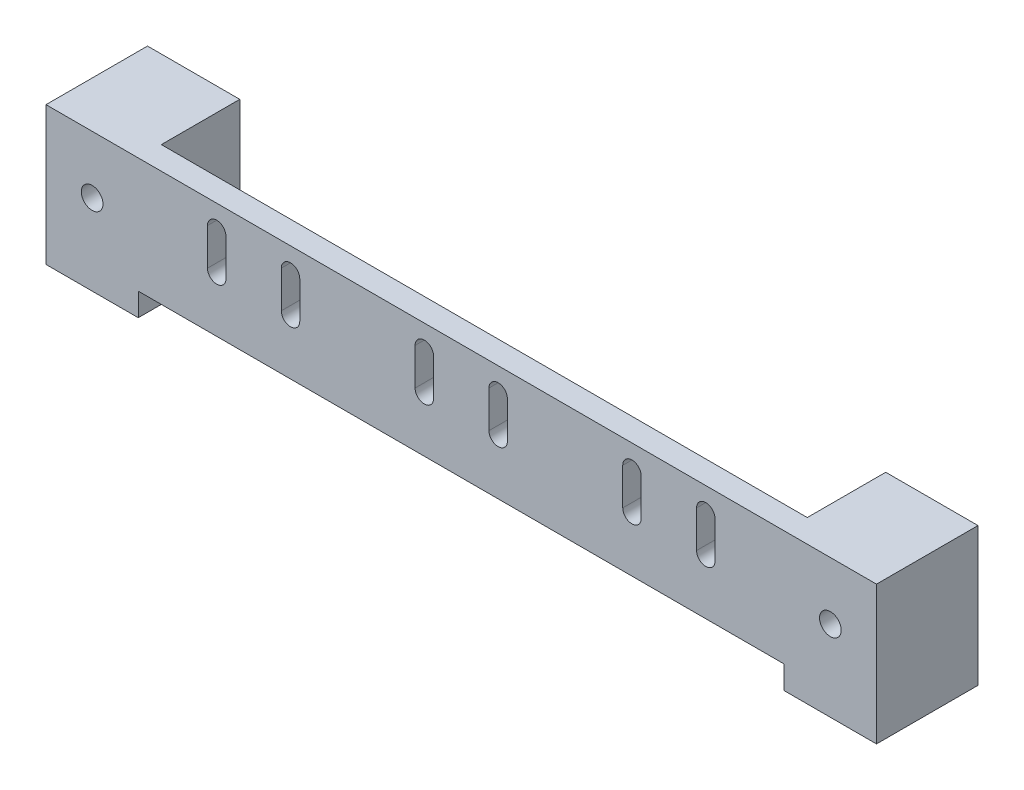
from build123d import *

# Parameters (mm, degrees)
SKETCH1_W           = 180
SKETCH1_H           = 30
SKETCH1_R           = 2.35
BOSS_EXTRUDE1_DEPTH = 22
SKETCH2_W           = 140
SKETCH2_H           = 17
CUT_EXTRUDE1_DEPTH  = 30
SKETCH3_W           = 140
SKETCH3_H           = 5
CUT_EXTRUDE2_DEPTH  = 22
CUT_EXTRUDE3_DEPTH  = 48


with BuildPart() as part:
    # Sketch1 → Boss-Extrude1 (new body)
    with BuildSketch(Plane.XY):
        with Locations((90, 15)):
            Rectangle(SKETCH1_W, SKETCH1_H)
        with Locations((10, 17.5)):
            Circle(SKETCH1_R, mode=Mode.SUBTRACT)
        with Locations((170, 17.5)):
            Circle(SKETCH1_R, mode=Mode.SUBTRACT)
    extrude(amount=BOSS_EXTRUDE1_DEPTH)

    # Sketch2 → Cut-Extrude1 (cut)
    with BuildSketch(Plane(origin=(0, 30, 0), x_dir=(1, 0, 0), z_dir=(0, 1, 0))):
        with Locations((90, -8.5)):
            Rectangle(SKETCH2_W, SKETCH2_H)
    extrude(amount=-CUT_EXTRUDE1_DEPTH, mode=Mode.SUBTRACT)

    # Sketch3 → Cut-Extrude2 (cut)
    with BuildSketch(Plane.XY.offset(22)):
        with Locations((90, 2.5)):
            Rectangle(SKETCH3_W, SKETCH3_H)
    extrude(amount=-CUT_EXTRUDE2_DEPTH, mode=Mode.SUBTRACT)

    # Sketch4 → Cut-Extrude3 (cut)
    with BuildSketch(Plane.XY.offset(22)):
        with BuildLine():
            Line((141, 16.808), (141, 24.808))
            ThreePointArc((141, 24.808), (143, 26.808), (145, 24.808))
            Line((145, 24.808), (145, 16.808))
            ThreePointArc((145, 16.808), (143, 14.808), (141, 16.808))
        make_face()
        with BuildLine():
            Line((96, 16.808), (96, 24.808))
            ThreePointArc((96, 24.808), (98, 26.808), (100, 24.808))
            Line((100, 24.808), (100, 16.808))
            ThreePointArc((100, 16.808), (98, 14.808), (96, 16.808))
        make_face()
        with BuildLine():
            Line((51, 16.808), (51, 24.808))
            ThreePointArc((51, 24.808), (53, 26.808), (55, 24.808))
            Line((55, 24.808), (55, 16.808))
            ThreePointArc((55, 16.808), (53, 14.808), (51, 16.808))
        make_face()
        with BuildLine():
            Line((35, 16.808), (35, 24.808))
            ThreePointArc((35, 24.808), (37, 26.808), (39, 24.808))
            Line((39, 24.808), (39, 16.808))
            ThreePointArc((39, 16.808), (37, 14.808), (35, 16.808))
        make_face()
        with BuildLine():
            Line((80, 16.808), (80, 24.808))
            ThreePointArc((80, 24.808), (82, 26.808), (84, 24.808))
            Line((84, 24.808), (84, 16.808))
            ThreePointArc((84, 16.808), (82, 14.808), (80, 16.808))
        make_face()
        with BuildLine():
            Line((125, 16.808), (125, 24.808))
            ThreePointArc((125, 24.808), (127, 26.808), (129, 24.808))
            Line((129, 24.808), (129, 16.808))
            ThreePointArc((129, 16.808), (127, 14.808), (125, 16.808))
        make_face()
    extrude(amount=-CUT_EXTRUDE3_DEPTH, mode=Mode.SUBTRACT)


solid = part.part
